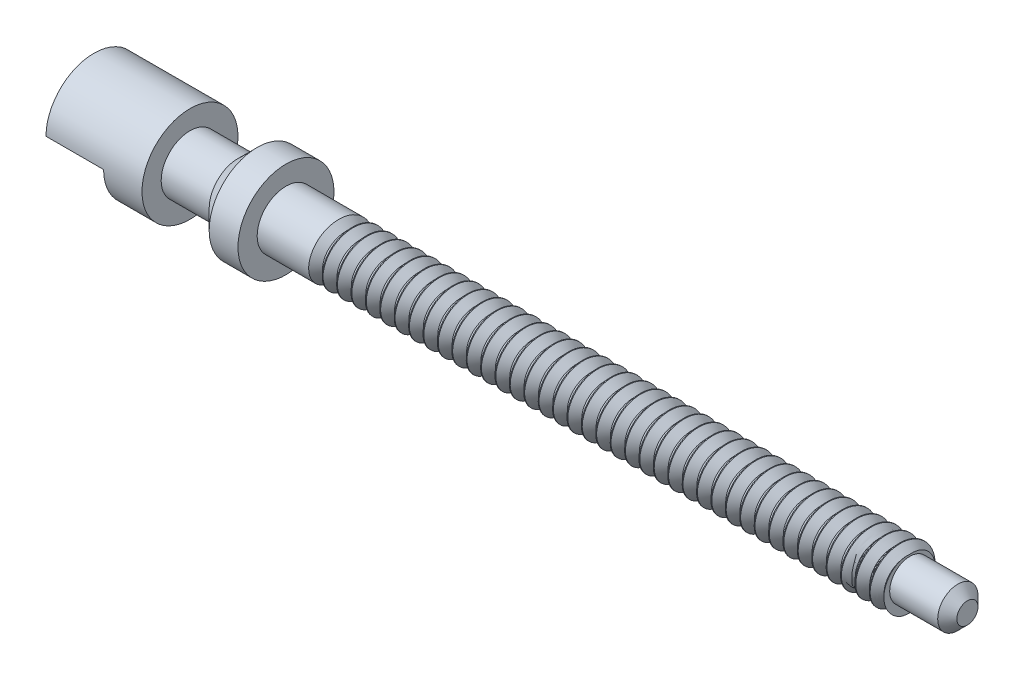
from build123d import *

# Parameters (mm, degrees)
SKETCH2_W          = 0.6
SKETCH2_H          = 1
CUT_EXTRUDE1_DEPTH = 9.529361055
CUT_SWEEP1_PITCH   = 0.15
SKETCH7_W          = 0.6
SKETCH7_H          = 0.21
CHAMFER1_SIZE      = 0.1


with BuildPart() as part:
    # Sketch1 → Revolve1 (revolve)
    with BuildSketch(Plane.XY, mode=Mode.PRIVATE) as revolve1_sk:
        Polygon((0, 0), (0, 0.5), (1, 0.5), (1, 0.3), (1.5, 0.3), (1.7, 0.5), (2, 0.5), (2, 0.3), (2.5, 0.3), (8.5, 0.3), (8.5, 0), align=None)
    revolve(revolve1_sk.sketch.rotate(Axis((0, 0, 0), (1, 0, 0)), 90), axis=Axis((0, 0, 0), (1, 0, 0)))

    # Sketch2 → Cut-Extrude1 (cut, through all)
    with BuildSketch(Plane(origin=(0, 0, 0), x_dir=(1, 0, 0), z_dir=(0, 1, 0))):
        with Locations((0.3, 0)):
            Rectangle(SKETCH2_W, SKETCH2_H)
    extrude(amount=-CUT_EXTRUDE1_DEPTH, mode=Mode.SUBTRACT)

    # Cut-Sweep1: arcs per turn and ends read off the stored shape
    # Cut-Sweep1: the profile of Sketch5 profile screwed along a left-hand helix through 40.75 turns, 6 arcs to a turn; built about Z, then put on its axis
    cut_sweep1_z = Axis((0, 0, 0), (0, 0, 1))
    cut_sweep1_corners = [(0.3003, 0, -0.07473024), (0.229273387, 0, -0.15), (0.3003, 0, -0.217022663)]
    with BuildLine(mode=Mode.PRIVATE) as cut_sweep1_profile:
        Line(cut_sweep1_corners[0], cut_sweep1_corners[1])
        Line(cut_sweep1_corners[1], cut_sweep1_corners[2])
        Line(cut_sweep1_corners[2], cut_sweep1_corners[0])
    cut_sweep1_cap = Face(cut_sweep1_profile.wire())
    cut_sweep1_turn_angles = [0, -30, -60, -90, -120, -150, -180, -210, -240, -270, -300, -330, -360]
    cut_sweep1_turn_weights = [1, 0.8660254037844387, 1, 0.8660254037844387, 1, 0.8660254037844387, 1, 0.8660254037844387, 1, 0.8660254037844387, 1, 0.8660254037844387, 1]
    cut_sweep1_turn_rails = [Edge.make_bspline([Vector(p[0], p[1], 0).rotate(cut_sweep1_z, cut_sweep1_turn_angles[k]) / cut_sweep1_turn_weights[k] + Vector(0, 0, p[2] + -CUT_SWEEP1_PITCH * cut_sweep1_turn_angles[k] / 360) for k in range(13)], [0, 0, 0, 1, 1, 2, 2, 3, 3, 4, 4, 5, 5, 6, 6, 6], 2, cut_sweep1_turn_weights) for p in cut_sweep1_corners]
    cut_sweep1_turn_sides = [Face.make_surface_from_curves(cut_sweep1_turn_rails[p[0]], cut_sweep1_turn_rails[p[1]]) for p in [(0, 1), (1, 2), (2, 0)]]
    cut_sweep1_last_angles = [-14400, -14430, -14460, -14490, -14520, -14550, -14580, -14610, -14640, -14655, -14670]
    cut_sweep1_last_weights = [1, 0.8660254037844387, 1, 0.8660254037844387, 1, 0.8660254037844387, 1, 0.8660254037844387, 1, 0.9659258262890683, 1]
    cut_sweep1_last_rails = [Edge.make_bspline([Vector(p[0], p[1], 0).rotate(cut_sweep1_z, cut_sweep1_last_angles[k]) / cut_sweep1_last_weights[k] + Vector(0, 0, p[2] + -CUT_SWEEP1_PITCH * cut_sweep1_last_angles[k] / 360) for k in range(11)], [0, 0, 0, 1, 1, 2, 2, 3, 3, 4, 4, 5, 5, 5], 2, cut_sweep1_last_weights) for p in cut_sweep1_corners]
    cut_sweep1_last_sides = [Face.make_surface_from_curves(cut_sweep1_last_rails[p[0]], cut_sweep1_last_rails[p[1]]) for p in [(0, 1), (1, 2), (2, 0)]]
    cut_sweep1 = Plane(origin=(8.5, 0, 0), x_dir=(0, 1, 0), z_dir=(-1, 0, 0)) * Solid(Shell([*[p.moved(Location((0, 0, CUT_SWEEP1_PITCH * i))) for i in range(40) for p in cut_sweep1_turn_sides], *cut_sweep1_last_sides, cut_sweep1_cap, cut_sweep1_cap.rotate(cut_sweep1_z, -14670).moved(Location((0, 0, -CUT_SWEEP1_PITCH * -14670 / 360)))]))
    add(cut_sweep1, mode=Mode.SUBTRACT)

    # Sketch7 → Revolve2 (revolve)
    with BuildSketch(Plane.XY, mode=Mode.PRIVATE) as revolve2_sk:
        with Locations((8.8, 0.105)):
            Rectangle(SKETCH7_W, SKETCH7_H)
    revolve(revolve2_sk.sketch.rotate(Axis((8.670644839, 0, 0), (1, 0, 0)), 90), axis=Axis((8.670644839, 0, 0), (1, 0, 0)))

    # Chamfer1
    chamfer1_edges = [part.edges().sort_by_distance(p)[0] for p in [
        (9.1, 0, -0.21),
    ]]
    chamfer(chamfer1_edges, length=CHAMFER1_SIZE)


solid = part.part
